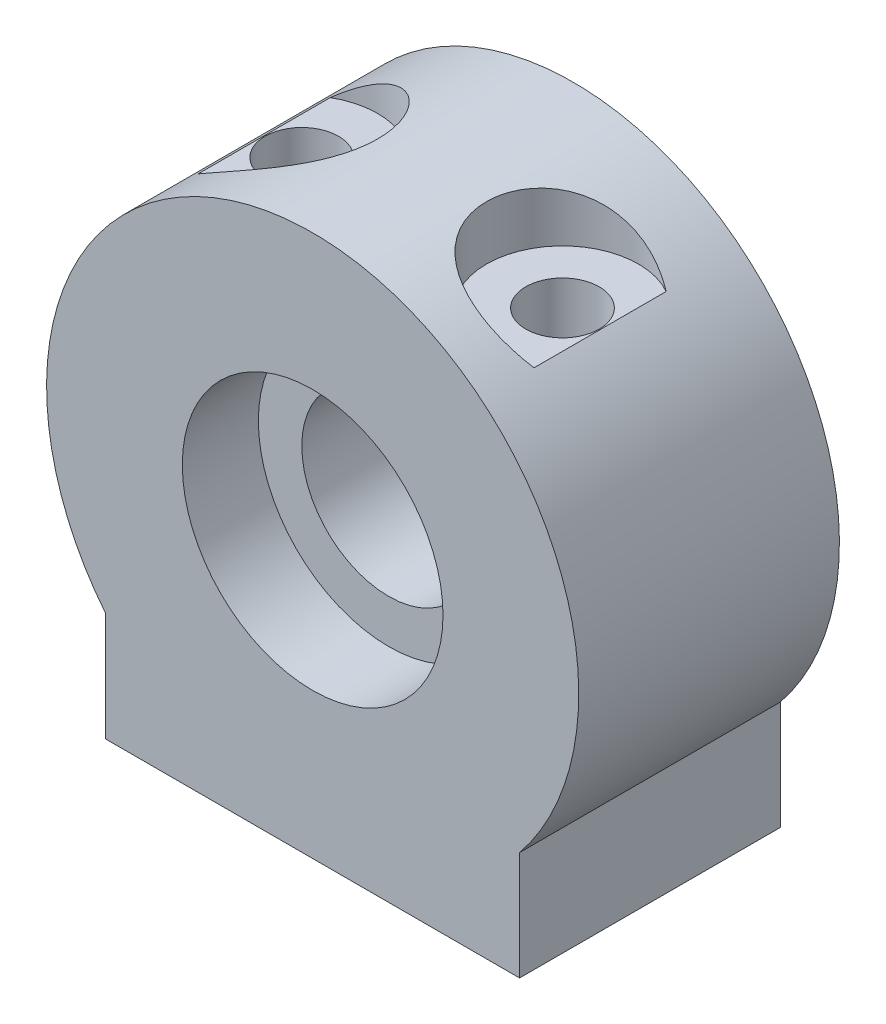
from build123d import *

# Parameters (mm, degrees)
SKETCH1_R               = 12
BOSS_EXTRUDE1_DEPTH     = 7
BOSS_EXTRUDE2_START     = -17
SKETCH2_R               = 8
BOSS_EXTRUDE2_DEPTH     = 17
CUT_EXTRUDE1_DEPTH      = 40.169152403
CUT_EXTRUDE1_DEPTH_BACK = 40.169152403
SKETCH3_R               = 3.38
CUT_EXTRUDE2_START      = 36
SKETCH4_R               = 7
CUT_EXTRUDE2_DEPTH      = 17


with BuildPart() as part:
    # Sketch1 → Boss-Extrude1 (new body)
    with BuildSketch(Plane.XY):
        with BuildLine():
            Line((-19.05, -25.4), (19.05, -25.4))
            Line((19.05, -25.4), (19.05, -15.4))
            ThreePointArc((19.05, -15.4), (0, 24.496173171), (-19.05, -15.4))
            Line((-19.05, -15.4), (-19.05, -25.4))
        make_face()
        Circle(SKETCH1_R, mode=Mode.SUBTRACT)
    extrude(amount=BOSS_EXTRUDE1_DEPTH)

    # Sketch2 → Boss-Extrude2 (add)
    with BuildSketch(Plane.XY.offset(BOSS_EXTRUDE2_START)):
        with BuildLine():
            Line((-19.05, -25.4), (19.05, -25.4))
            Line((19.05, -25.4), (19.05, -15.4))
            ThreePointArc((19.05, -15.4), (0, 24.496173171), (-19.05, -15.4))
            Line((-19.05, -15.4), (-19.05, -25.4))
        make_face()
        Circle(SKETCH2_R, mode=Mode.SUBTRACT)
    extrude(amount=BOSS_EXTRUDE2_DEPTH)

    # Sketch3 → Cut-Extrude1 (cut, two sides: drawn at the far end of the back side and taken through both)
    with BuildSketch(Plane(origin=(0, 0, 0), x_dir=(1, 0, 0), z_dir=(0, 1, 0)).offset(-CUT_EXTRUDE1_DEPTH_BACK)):
        with Locations((-12, 4)):
            Circle(SKETCH3_R)
        with Locations((12, 4)):
            Circle(SKETCH3_R)
    extrude(amount=CUT_EXTRUDE1_DEPTH + CUT_EXTRUDE1_DEPTH_BACK, mode=Mode.SUBTRACT)

    # Sketch4 → Cut-Extrude2 (cut)
    with BuildSketch(Plane(origin=(0, 0, 0), x_dir=(1, 0, 0), z_dir=(0, 1, 0)).offset(CUT_EXTRUDE2_START)):
        with Locations((-12, 4)):
            Circle(SKETCH4_R)
        with Locations((12, 4)):
            Circle(SKETCH4_R)
    extrude(amount=-CUT_EXTRUDE2_DEPTH, mode=Mode.SUBTRACT)


solid = part.part
